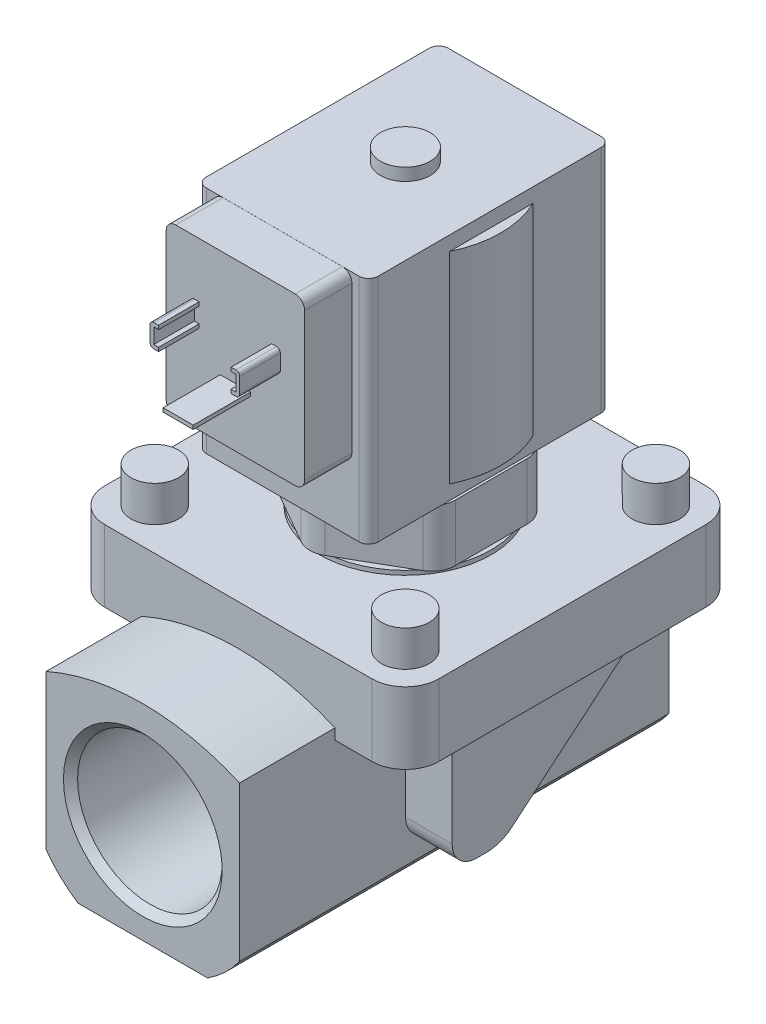
from build123d import *

# Parameters (mm, degrees)
IZIM1_W                      = 50.7
IZIM1_H                      = 48.2
Y_KSEKLIK_EKSTR_ZYON1_DEPTH  = 26.7
IZIM2_R                      = 8.7
Y_KSEKLIK_EKSTR_ZYON2_DEPTH  = 0.5
Y_KSEKLIK_EKSTR_ZYON3_DEPTH  = 11.9
IZIM4_R                      = 16.5
Y_KSEKLIK_EKSTR_ZYON4_DEPTH  = 0.9
IZIM5_R                      = 18
Y_KSEKLIK_EKSTR_ZYON5_DEPTH  = 0.9
Y_KSEKLIK_EKSTR_ZYON6_DEPTH  = 36
Y_KSEKLIK_EKSTR_ZYON7_DEPTH  = 17
Y_KSEKLIK_EKSTR_ZYON8_START  = 17
Y_KSEKLIK_EKSTR_ZYON8_DEPTH  = 17
IZIM9_W                      = 14.75
IZIM9_H                      = 70
KES_EKSTR_ZYON1_DEPTH        = 30.160746911
IZIM10_W                     = 14.75
IZIM10_H                     = 70
KES_EKSTR_ZYON2_DEPTH        = 30.160746911
IZIM11_W                     = 50.7
IZIM11_H                     = 48.2
Y_KSEKLIK_EKSTR_ZYON9_DEPTH  = 9.3
Y_KSEKLIK_EKSTR_ZYON10_START = 20
Y_KSEKLIK_EKSTR_ZYON10_DEPTH = 20
IZIM13_W                     = 9.75
IZIM13_H                     = 10.2
Y_KSEKLIK_EKSTR_ZYON11_DEPTH = 26.5
Y_KSEKLIK_EKSTR_ZYON12_DEPTH = 42.2
Y_KSEKLIK_EKSTR_ZYON13_START = -42.2
Y_KSEKLIK_EKSTR_ZYON13_DEPTH = 42.2
IZIM16_W                     = 29
IZIM16_H                     = 34.79
Y_KSEKLIK_EKSTR_ZYON14_DEPTH = 9.9
Y_KSEKLIK_EKSTR_ZYON15_DEPTH = 8.5
Y_KSEKLIK_EKSTR_ZYON16_DEPTH = 8.5
IZIM19_W                     = 6.3
IZIM19_H                     = 0.8
Y_KSEKLIK_EKSTR_ZYON17_DEPTH = 12
DRAFT1_ANGLE                 = 50
IZIM20_W                     = 5
IZIM20_H                     = 7.5
IZIM21_W                     = 5
IZIM21_H                     = 7.5
IZIM22_W                     = 5
IZIM22_H                     = 7.5
IZIM23_W                     = 5
IZIM23_H                     = 7.5
IZIM24_W                     = 5.2
IZIM24_H                     = 2.6
M27_BO_LUKLU_DELIK1_D        = 30.291
M27_BO_LUKLU_DELIK1_DEPTH    = 33.249
M27_BO_LUKLU_DELIK2_D        = 30.291
M27_BO_LUKLU_DELIK2_DEPTH    = 33.249
FEDER1_START                 = -30
FEDER1_DEPTH                 = 9.75
PAH1_SIZE                    = 1.479
RADYUS1_R                    = 0.8
RADYUS2_R                    = 2
RADYUS3_R                    = 5
RADYUS4_R                    = 5.1
RADYUS5_R                    = 7
RADYUS6_R                    = 8.16
L_EK1_SCALE                  = 0.27


# Read off the part's stored shape, not the designer's step: Feder1
with BuildPart() as part:
    # Çizim1 → Yükseklik-Ekstrüzyon1 (new body)
    with BuildSketch(Plane(origin=(18, 0, 0), x_dir=(0, 0, -1), z_dir=(1, 0, 0))):
        with Locations((-0.35, 68.8)):
            Rectangle(IZIM1_W, IZIM1_H)
    extrude(amount=-Y_KSEKLIK_EKSTR_ZYON1_DEPTH)

    # Çizim2 → Yükseklik-Ekstrüzyon2 (add)
    with BuildSketch(Plane.XZ.offset(-44.7)):
        with Locations(Location((0, 0, 0), (0, 0, 180))):
            Circle(IZIM2_R)
    extrude(amount=Y_KSEKLIK_EKSTR_ZYON2_DEPTH)

    # Çizim3 → Yükseklik-Ekstrüzyon3 (add)
    with BuildSketch(Plane(origin=(0, 44.2, 0), x_dir=(1, 0, 0), z_dir=(0, 1, 0))):
        Polygon((-18, 10.392304845), (-18, -10.392304845), (0, -20.784609691), (18, -10.392304845), (18, 10.392304845), (0, 20.784609691), align=None)
    extrude(amount=-Y_KSEKLIK_EKSTR_ZYON3_DEPTH)

    # Çizim4 → Yükseklik-Ekstrüzyon4 (add)
    with BuildSketch(Plane.XZ.offset(-32.3)):
        with Locations(Location((0, 0, 0), (0, 0, 270))):
            Circle(IZIM4_R)
    extrude(amount=Y_KSEKLIK_EKSTR_ZYON4_DEPTH)

    # Çizim5 → Yükseklik-Ekstrüzyon5 (add)
    with BuildSketch(Plane(origin=(0, 31.4, 0), x_dir=(1, 0, 0), z_dir=(0, 1, 0))):
        with Locations(Location((0, 0, 0), (0, 0, 90))):
            Circle(IZIM5_R)
    extrude(amount=-Y_KSEKLIK_EKSTR_ZYON5_DEPTH)

    # Çizim6 → Yükseklik-Ekstrüzyon6 (add)
    with BuildSketch(Plane.XY.offset(18)):
        with BuildLine():
            Line((-13.564659966, -21), (13.564659966, -21))
            ThreePointArc((13.564659966, -21), (17.201870235, -18.14099392), (20.25, -14.660746911))
            Line((20.25, -14.660746911), (35, -14.660746911))
            Line((35, -14.660746911), (35, 30.5))
            Line((35, 30.5), (0, 30.5))
            Line((0, 30.5), (-35, 30.5))
            Line((-35, 30.5), (-35, -14.660746911))
            Line((-35, -14.660746911), (-20.25, -14.660746911))
            ThreePointArc((-20.25, -14.660746911), (-17.201870235, -18.14099392), (-13.564659966, -21))
        make_face()
    extrude(amount=-Y_KSEKLIK_EKSTR_ZYON6_DEPTH)

    # Çizim7 → Yükseklik-Ekstrüzyon7 (add)
    with BuildSketch(Plane(origin=(0, 0, -18), x_dir=(-1, 0, 0), z_dir=(0, 0, -1))):
        with BuildLine():
            Line((13.564659966, -21), (-13.564659966, -21))
            ThreePointArc((-13.564659966, -21), (-17.201870235, -18.14099392), (-20.25, -14.660746911))
            Line((-20.25, -14.660746911), (-35, -14.660746911))
            Line((-35, -14.660746911), (-35, 30.5))
            Line((-35, 30.5), (35, 30.5))
            Line((35, 30.5), (35, -14.660746911))
            Line((35, -14.660746911), (20.25, -14.660746911))
            ThreePointArc((20.25, -14.660746911), (17.201870235, -18.14099392), (13.564659966, -21))
        make_face()
    extrude(amount=Y_KSEKLIK_EKSTR_ZYON7_DEPTH)

    # Çizim8 → Yükseklik-Ekstrüzyon8 (add)
    with BuildSketch(Plane.XY.offset(18).offset(Y_KSEKLIK_EKSTR_ZYON8_START)):
        with BuildLine():
            Line((13.564659966, -21), (-13.564659966, -21))
            ThreePointArc((-13.564659966, -21), (-17.201870235, -18.14099392), (-20.25, -14.660746911))
            Line((-20.25, -14.660746911), (-35, -14.660746911))
            Line((-35, -14.660746911), (-35, 30.5))
            Line((-35, 30.5), (35, 30.5))
            Line((35, 30.5), (35, -14.660746911))
            Line((35, -14.660746911), (20.25, -14.660746911))
            ThreePointArc((20.25, -14.660746911), (17.201870235, -18.14099392), (13.564659966, -21))
        make_face()
    extrude(amount=-Y_KSEKLIK_EKSTR_ZYON8_DEPTH)

    # Çizim9 → Kes-Ekstrüzyon1 (cut)
    with BuildSketch(Plane.XZ.offset(14.660746911)):
        with Locations((27.625, 0)):
            Rectangle(IZIM9_W, IZIM9_H)
    extrude(amount=-KES_EKSTR_ZYON1_DEPTH, mode=Mode.SUBTRACT)

    # Çizim10 → Kes-Ekstrüzyon2 (cut)
    with BuildSketch(Plane.XZ.offset(14.660746911)):
        with Locations((-27.625, 0)):
            Rectangle(IZIM10_W, IZIM10_H)
    extrude(amount=-KES_EKSTR_ZYON2_DEPTH, mode=Mode.SUBTRACT)

    # Çizim11 → Yükseklik-Ekstrüzyon9 (add)
    with BuildSketch(Plane.ZY.offset(8.7)):
        with Locations((0.35, 68.8)):
            Rectangle(IZIM11_W, IZIM11_H)
    extrude(amount=Y_KSEKLIK_EKSTR_ZYON9_DEPTH)

    # Çizim12 → Yükseklik-Ekstrüzyon10 (add)
    with BuildSketch(Plane.XY.offset(35).offset(Y_KSEKLIK_EKSTR_ZYON10_START)):
        with BuildLine():
            Line((-20.25, -14.660746911), (-20.25, 17.715834237))
            ThreePointArc((-20.25, 17.715834237), (0, 22), (20.25, 17.715834237))
            Line((20.25, 17.715834237), (20.25, -14.660746911))
            ThreePointArc((20.25, -14.660746911), (17.201870235, -18.14099392), (13.564659966, -21))
            Line((13.564659966, -21), (-13.564659966, -21))
            ThreePointArc((-13.564659966, -21), (-17.201870235, -18.14099392), (-20.25, -14.660746911))
        make_face()
    extrude(amount=-Y_KSEKLIK_EKSTR_ZYON10_DEPTH)

    # Çizim13 → Yükseklik-Ekstrüzyon11 (add)
    with BuildSketch(Plane.XZ.offset(-15.5)):
        with Locations((25.125, 15.1)):
            Rectangle(IZIM13_W, IZIM13_H)
    extrude(amount=Y_KSEKLIK_EKSTR_ZYON11_DEPTH)

    # Çizim14 → Yükseklik-Ekstrüzyon12 (add)
    with BuildSketch(Plane(origin=(0, 89.9, 0), x_dir=(1, 0, 0), z_dir=(0, 1, 0))):
        with BuildLine():
            Line((-18, -8.717797887), (-18, 8.717797887))
            ThreePointArc((-18, 8.717797887), (-20, 0), (-18, -8.717797887))
        make_face()
    extrude(amount=-Y_KSEKLIK_EKSTR_ZYON12_DEPTH)

    # Çizim15 → Yükseklik-Ekstrüzyon13 (add)
    with BuildSketch(Plane.XZ.offset(-47.7).offset(Y_KSEKLIK_EKSTR_ZYON13_START)):
        with BuildLine():
            Line((18, 8.717797887), (18, -8.717797887))
            ThreePointArc((18, -8.717797887), (20, 0), (18, 8.717797887))
        make_face()
    extrude(amount=Y_KSEKLIK_EKSTR_ZYON13_DEPTH)

    # Çizim16 → Yükseklik-Ekstrüzyon14 (add)
    with BuildSketch(Plane.XY.offset(25.7)):
        with Locations((0, 75.495)):
            Rectangle(IZIM16_W, IZIM16_H)
    extrude(amount=Y_KSEKLIK_EKSTR_ZYON14_DEPTH)

    # Çizim17 → Yükseklik-Ekstrüzyon15 (add)
    with BuildSketch(Plane.XY.offset(35.6)):
        Polygon((-9.4, 81.4), (-7.6, 81.4), (-7.6, 80.6), (-8.6, 80.6), (-8.6, 77.4), (-7.6, 77.4), (-7.6, 76.6), (-9.4, 76.6), align=None)
    extrude(amount=Y_KSEKLIK_EKSTR_ZYON15_DEPTH)

    # Çizim18 → Yükseklik-Ekstrüzyon16 (add)
    with BuildSketch(Plane.XY.offset(35.6)):
        Polygon((7.6, 77.4), (8.6, 77.4), (8.6, 80.6), (7.6, 80.6), (7.6, 81.4), (9.4, 81.4), (9.4, 76.6), (7.6, 76.6), align=None)
    extrude(amount=Y_KSEKLIK_EKSTR_ZYON16_DEPTH)

    # Çizim19 → Yükseklik-Ekstrüzyon17 (add)
    with BuildSketch(Plane.XY.offset(35.6)):
        with Locations((0, 70)):
            Rectangle(IZIM19_W, IZIM19_H)
    extrude(amount=Y_KSEKLIK_EKSTR_ZYON17_DEPTH)

    # Draft1
    draft1_faces = [part.faces().sort_by_distance(p)[0] for p in [
        (25.125, 2.25, 10),
    ]]
    draft(draft1_faces, Plane(origin=(0, -11, 0), x_dir=(0, 0, -1), z_dir=(0, -1, 0)), DRAFT1_ANGLE)

    # Çizim20 → Döndür1 (revolve)
    with BuildSketch(Plane.XY.offset(26.25), mode=Mode.PRIVATE) as d_nd_r1_sk:
        with Locations((-23.75, 34.25)):
            Rectangle(IZIM20_W, IZIM20_H)
    revolve(d_nd_r1_sk.sketch.rotate(Axis((-26.25, 38, 26.25), (0, -1, 0)), 270), axis=Axis((-26.25, 38, 26.25), (0, -1, 0)))

    # Çizim21 → Döndür2 (revolve)
    with BuildSketch(Plane.XY.offset(-26.25), mode=Mode.PRIVATE) as d_nd_r2_sk:
        with Locations((-23.75, 34.25)):
            Rectangle(IZIM21_W, IZIM21_H)
    revolve(d_nd_r2_sk.sketch.rotate(Axis((-26.25, 38, -26.25), (0, -1, 0)), 270), axis=Axis((-26.25, 38, -26.25), (0, -1, 0)))

    # Çizim22 → Döndür3 (revolve)
    with BuildSketch(Plane.XY.offset(-26.25), mode=Mode.PRIVATE) as d_nd_r3_sk:
        with Locations((28.75, 34.25)):
            Rectangle(IZIM22_W, IZIM22_H)
    revolve(d_nd_r3_sk.sketch.rotate(Axis((26.25, 38, -26.25), (0, -1, 0)), 270), axis=Axis((26.25, 38, -26.25), (0, -1, 0)))

    # Çizim23 → Döndür4 (revolve)
    with BuildSketch(Plane.XY.offset(26.25), mode=Mode.PRIVATE) as d_nd_r4_sk:
        with Locations((28.75, 34.25)):
            Rectangle(IZIM23_W, IZIM23_H)
    revolve(d_nd_r4_sk.sketch.rotate(Axis((26.25, 38, 26.25), (0, -1, 0)), 270), axis=Axis((26.25, 38, 26.25), (0, -1, 0)))

    # Çizim24 → Döndür5 (revolve)
    with BuildSketch(Plane(origin=(0, 0, 0), x_dir=(-1, 0, 0), z_dir=(0, 0, -1)), mode=Mode.PRIVATE) as d_nd_r5_sk:
        with Locations((-2.6, 94.2)):
            Rectangle(IZIM24_W, IZIM24_H)
    revolve(d_nd_r5_sk.sketch.rotate(Axis((0, 92.9, 0), (0, 1, 0)), 90), axis=Axis((0, 92.9, 0), (0, 1, 0)))

    # M27 Boşluklu Delik1
    with Locations(Plane.XY.offset(55)):
        with Locations((0, 0)):
            Hole(M27_BO_LUKLU_DELIK1_D / 2, depth=M27_BO_LUKLU_DELIK1_DEPTH)

    # M27 Boşluklu Delik2
    with Locations(Plane(origin=(0, 0, -35), x_dir=(-1, 0, 0), z_dir=(0, 0, -1))):
        with Locations((0, 0)):
            Hole(M27_BO_LUKLU_DELIK2_D / 2, depth=M27_BO_LUKLU_DELIK2_DEPTH)

    # Feder1 outline → Feder1 (add)
    with BuildSketch(Plane.YZ.offset(FEDER1_START)):
        Polygon((15.5, 19.826070485), (-9.313312955, 19.826070485), (-12.686687045, 12.591846402), (15.5, -20.999739147), align=None)
    extrude(amount=FEDER1_DEPTH)

    # Pah1
    pah1_edges = [part.edges().sort_by_distance(p)[0] for p in [
        (15.1455, 0, 55),
        (-15.1455, 0, -35),
    ]]
    chamfer(pah1_edges, length=PAH1_SIZE)

    # Radyus1
    radyus1_edges = [part.edges().sort_by_distance(p)[0] for p in [
        (-9.4, 81.4, 39.85),
        (-9.4, 76.6, 39.85),
        (9.4, 76.6, 39.85),
        (9.4, 81.4, 39.85),
    ]]
    fillet(radyus1_edges, radius=RADYUS1_R)

    # Radyus2
    radyus2_edges = [part.edges().sort_by_distance(p)[0] for p in [
        (-18, 68.8, -25),
        (-18, 68.8, 25.7),
        (-14.5, 92.89, 30.65),
        (-14.5, 58.1, 30.65),
        (14.5, 58.1, 30.65),
        (14.5, 92.89, 30.65),
        (18, 68.8, 25.7),
        (18, 68.8, -25),
    ]]
    fillet(radyus2_edges, radius=RADYUS2_R)

    # Radyus3
    radyus3_edges = [part.edges().sort_by_distance(p)[0] for p in [
        (-18, 38.25, -10.392304845),
        (0, 38.25, -20.784609691),
        (18, 38.25, -10.392304845),
        (18, 38.25, 10.392304845),
        (0, 38.25, 20.784609691),
        (-18, 38.25, 10.392304845),
    ]]
    fillet(radyus3_edges, radius=RADYUS3_R)

    # Radyus4
    radyus4_edges = [part.edges().sort_by_distance(p)[0] for p in [
        (25.125, -11, 20.2),
    ]]
    fillet(radyus4_edges, radius=RADYUS4_R)

    # Radyus5
    radyus5_edges = [part.edges().sort_by_distance(p)[0] for p in [
        (35, 23, 35),
        (-35, 23, -35),
        (35, 23, -35),
        (-35, 23, 35),
    ]]
    fillet(radyus5_edges, radius=RADYUS5_R)

    # Radyus6
    radyus6_edges = [part.edges().sort_by_distance(p)[0] for p in [
        (25.125, -11, 10),
    ]]
    fillet(radyus6_edges, radius=RADYUS6_R)


with BuildPart() as part_1:
    # Ölçek1: scaled about (0.014445195, 31.538640435, 4.897050437)
    add(part.part.scale(L_EK1_SCALE).moved(Location((0.010544992, 23.023207518, 3.574846819))))


solid = part_1.part
